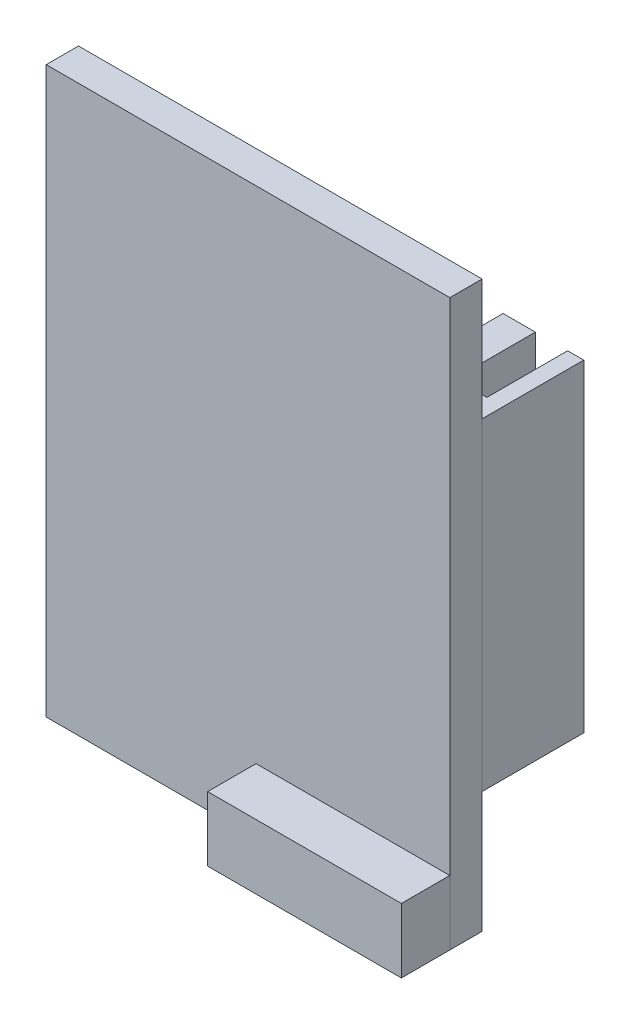
from build123d import *

# Parameters (mm, degrees)
CROQUIS1_W              = 25
CROQUIS1_H              = 35
SALIENTE_EXTRUIR1_DEPTH = 2
CROQUIS2_W              = 12
CROQUIS2_H              = 4
SALIENTE_EXTRUIR2_DEPTH = 3
CROQUIS4_W              = 25
CROQUIS4_H              = 20
SALIENTE_EXTRUIR3_DEPTH = 6.3
CROQUIS5_W              = 2
CROQUIS5_H              = 5
CORTAR_EXTRUIR1_DEPTH   = 20


# Read off the part's stored shape, not the designer's step: Partir1, Partir2
with BuildPart() as part:
    # Croquis1 → Saliente-Extruir1 (new body)
    with BuildSketch(Plane.XY):
        with Locations((-28.152566884, -5.555555556)):
            Rectangle(CROQUIS1_W, CROQUIS1_H)
    extrude(amount=SALIENTE_EXTRUIR1_DEPTH)

    # Croquis2 → Saliente-Extruir2 (add)
    with BuildSketch(Plane.XY.offset(2)):
        with Locations((-21.652566884, -21.055555556)):
            Rectangle(CROQUIS2_W, CROQUIS2_H)
    extrude(amount=SALIENTE_EXTRUIR2_DEPTH)

    # Croquis4 → Saliente-Extruir3 (add)
    with BuildSketch(Plane(origin=(0, 0, 0), x_dir=(-1, 0, 0), z_dir=(0, 0, -1))):
        with Locations((28.152566884, -5.555555556)):
            Rectangle(CROQUIS4_W, CROQUIS4_H)
    extrude(amount=SALIENTE_EXTRUIR3_DEPTH)

    # Croquis5 → Cortar-Extruir1 (cut)
    with BuildSketch(Plane(origin=(0, 4.444444444, 0), x_dir=(1, 0, 0), z_dir=(0, 1, 0))):
        with Locations((-17.652566884, 3.8)):
            Rectangle(CROQUIS5_W, CROQUIS5_H)
        with Locations((-21.652566884, 3.8)):
            Rectangle(CROQUIS5_W, CROQUIS5_H)
        with Locations((-25.652566884, 3.8)):
            Rectangle(CROQUIS5_W, CROQUIS5_H)
        with Locations((-29.652566884, 3.8)):
            Rectangle(CROQUIS5_W, CROQUIS5_H)
        with Locations((-33.652566884, 3.8)):
            Rectangle(CROQUIS5_W, CROQUIS5_H)
        with Locations((-37.652566884, 3.8)):
            Rectangle(CROQUIS5_W, CROQUIS5_H)
    extrude(amount=-CORTAR_EXTRUIR1_DEPTH, mode=Mode.SUBTRACT)


with BuildPart() as body_2:
    # Partir1: the piece on the far side of the plane
    add(part.part)
    split(bisect_by=Plane.XY.offset(2), keep=Keep.BOTTOM)


with BuildPart() as part_1:
    add(part.part)

    # Partir1
    split(bisect_by=Plane.XY.offset(2), keep=Keep.TOP)


with BuildPart() as body_3:
    # Partir2: the piece on the far side of the plane
    add(body_2.part)
    split(bisect_by=Plane.XY, keep=Keep.BOTTOM)


with BuildPart() as body_2_1:
    add(body_2.part)

    # Partir2
    split(bisect_by=Plane.XY, keep=Keep.TOP)


solid = Compound([part_1.part, body_3.part, body_2_1.part])
